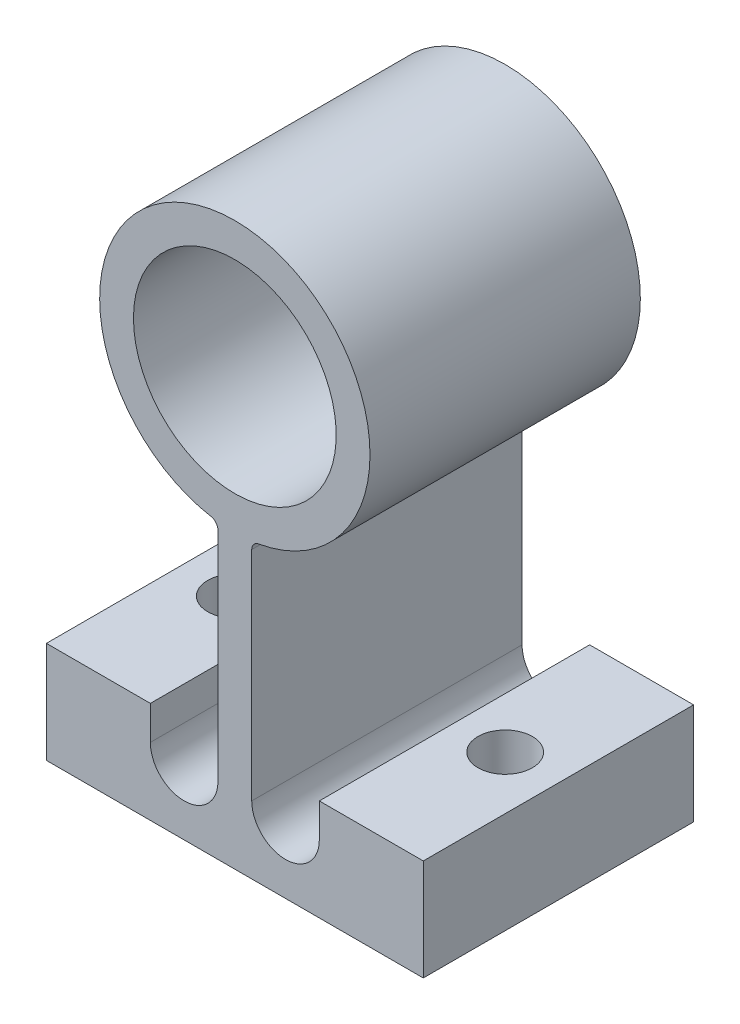
from build123d import *

# Parameters (mm, degrees)
SKETCH1_R                  = 9.525
EXTRUDE1_DEPTH             = 12.7
BUSHING_SIDE_FILLETS_R     = 0.79375
MOUNT_SIDE_FILLETS_R       = 0.79375
F_1_4_MOUNTING_HOLES_D     = 5.1054
F_1_4_MOUNTING_HOLES_DEPTH = 19.05
F_1_4_MOUNTING_HOLES_TIP   = 1.533816902
EXTRUDE2_DEPTH             = 51.649420448


with BuildPart() as part:
    # Sketch1 → Extrude1 (new, symmetric)
    with BuildSketch(Plane(origin=(0, 0, 0), x_dir=(1, 0, 0), z_dir=(0, 0, -1))):
        with BuildLine():
            Line((-17.705953405, 40.0837), (17.705953405, 40.0837))
            Line((17.705953405, 40.0837), (17.705953405, 30.5587))
            Line((17.705953405, 30.5587), (1.5875, 30.5587))
            Line((1.5875, 30.5587), (1.5875, 12.600390619))
            ThreePointArc((1.5875, 12.600390619), (0, -12.7), (-1.5875, 12.600390619))
            Line((-1.5875, 12.600390619), (-1.5875, 30.5587))
            Line((-1.5875, 30.5587), (-17.705953405, 30.5587))
            Line((-17.705953405, 30.5587), (-17.705953405, 40.0837))
        make_face()
        Circle(SKETCH1_R, mode=Mode.SUBTRACT)
    extrude(amount=EXTRUDE1_DEPTH, both=True)

    # Bushing-side fillets
    bushing_side_fillets_edges = [part.edges().sort_by_distance(p)[0] for p in [
        (1.5875, -12.600390619, 0),
        (-1.5875, -12.600390619, 0),
    ]]
    fillet(bushing_side_fillets_edges, radius=BUSHING_SIDE_FILLETS_R)

    # Mount-side fillets
    mount_side_fillets_edges = [part.edges().sort_by_distance(p)[0] for p in [
        (1.5875, -30.5587, 0),
        (-1.5875, -30.5587, 0),
    ]]
    fillet(mount_side_fillets_edges, radius=MOUNT_SIDE_FILLETS_R)

    # 1/4 Mounting holes
    with Locations(Plane.XZ.offset(40.0837)):
        with Locations((-12.7, 0), (12.7, 0)):
            Hole(F_1_4_MOUNTING_HOLES_D / 2, depth=F_1_4_MOUNTING_HOLES_DEPTH)
            with Locations((0, 0, -(F_1_4_MOUNTING_HOLES_DEPTH + F_1_4_MOUNTING_HOLES_TIP / 2))):  # 118° drill point
                Cone(0, F_1_4_MOUNTING_HOLES_D / 2, F_1_4_MOUNTING_HOLES_TIP, mode=Mode.SUBTRACT)

    # Sketch4 → Extrude2 (cut, through all)
    with BuildSketch(Plane(origin=(0, 0, -12.7), x_dir=(-1, 0, 0), z_dir=(0, 0, -1))):
        with BuildLine():
            Line((1.5875, -29.76495), (1.5875, -33.7337))
            ThreePointArc((1.5875, -33.7337), (4.7625, -36.9087), (7.9375, -33.7337))
            Line((7.9375, -33.7337), (7.9375, -30.5587))
            Line((7.9375, -30.5587), (2.38125, -30.5587))
            ThreePointArc((2.38125, -30.5587), (1.819983992, -30.326216008), (1.5875, -29.76495))
        make_face()
        with BuildLine():
            Line((-7.9375, -30.5587), (-2.38125, -30.5587))
            ThreePointArc((-2.38125, -30.5587), (-1.819983992, -30.326216008), (-1.5875, -29.76495))
            Line((-1.5875, -29.76495), (-1.5875, -33.7337))
            ThreePointArc((-1.5875, -33.7337), (-4.7625, -36.9087), (-7.9375, -33.7337))
            Line((-7.9375, -33.7337), (-7.9375, -30.5587))
        make_face()
    extrude(amount=-EXTRUDE2_DEPTH, mode=Mode.SUBTRACT)


solid = part.part
